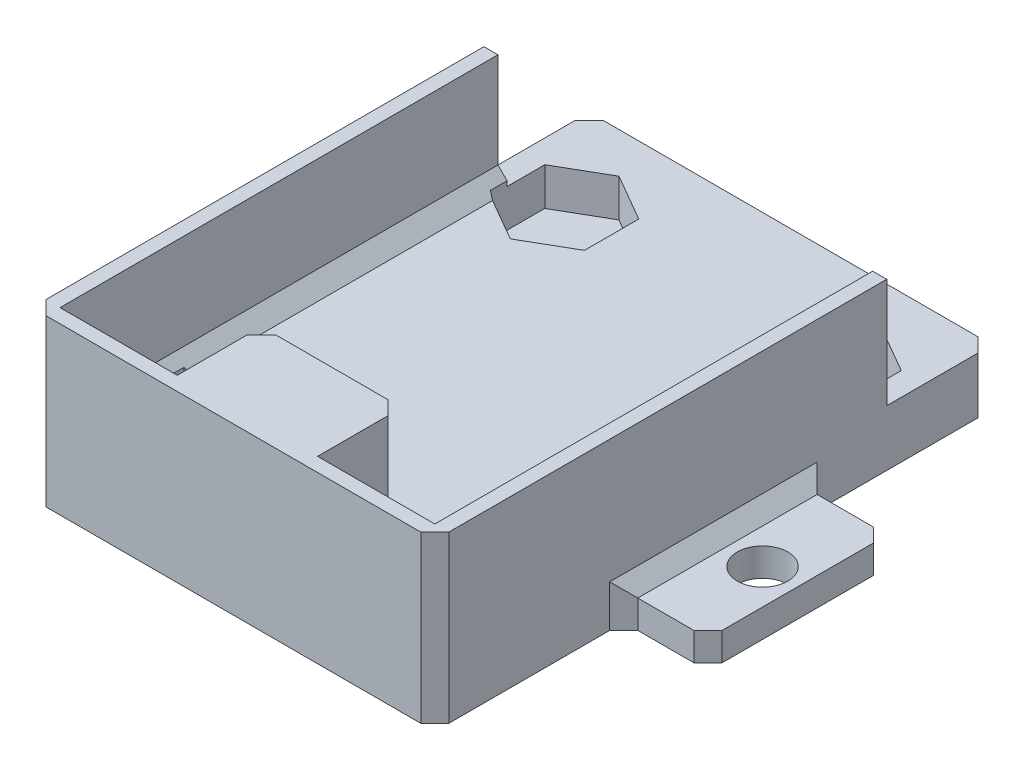
from build123d import *

# Parameters (mm, degrees)
SKETCH2_W               = 28.7
SKETCH2_H               = 39.7
BOSS_EXTRUDE1_DEPTH     = 10.8
SKETCH3_W               = 26.7
SKETCH3_H               = 37.7
CUT_EXTRUDE1_DEPTH      = 7.8
CUT_EXTRUDE2_DEPTH      = 37.528790016
CUT_EXTRUDE2_DEPTH_BACK = 37.528790016
SKETCH4_W               = 7.5
SKETCH4_H               = 7.8
SKETCH6_W               = 28.7
SKETCH6_H               = 39.7
BOSS_EXTRUDE2_DEPTH     = 1
CUT_EXTRUDE3_DEPTH      = 26.705738659
CUT_EXTRUDE3_DEPTH_BACK = 2.7
SKETCH10_W              = 12.7769089
SKETCH10_H              = 2
BOSS_EXTRUDE3_DEPTH     = 6
SKETCH11_R              = 1.8
CUT_EXTRUDE4_DEPTH      = 31.069669104
SKETCH12_W              = 12.78
SKETCH12_H              = 2
BOSS_EXTRUDE4_DEPTH     = 6
SKETCH14_R              = 1.8
CUT_EXTRUDE5_DEPTH      = 31.069669104
CHAMFER1_SIZE           = 1
SKETCH16_W              = 10
SKETCH16_H              = 6
BOSS_EXTRUDE5_DEPTH     = 7.8
CHAMFER2_SIZE           = 1


with BuildPart() as part:
    # Sketch2 → Boss-Extrude1 (new body)
    with BuildSketch(Plane(origin=(0, 0, 0), x_dir=(1, 0, 0), z_dir=(0, 1, 0))):
        Rectangle(SKETCH2_W, SKETCH2_H)
    extrude(amount=BOSS_EXTRUDE1_DEPTH)

    # Sketch3 → Cut-Extrude1 (cut)
    with BuildSketch(Plane(origin=(0, 10.8, 0), x_dir=(1, 0, 0), z_dir=(0, 1, 0))):
        Rectangle(SKETCH3_W, SKETCH3_H)
    extrude(amount=-CUT_EXTRUDE1_DEPTH, mode=Mode.SUBTRACT)

    # Sketch4 → Cut-Extrude2 (cut, two sides: drawn at the far end of the back side and taken through both)
    with BuildSketch(Plane(origin=(14.35, 0, 0), x_dir=(0, 0, -1), z_dir=(1, 0, 0)).offset(-CUT_EXTRUDE2_DEPTH_BACK)):
        with Locations((16.1, 6.9)):
            Rectangle(SKETCH4_W, SKETCH4_H)
    extrude(amount=CUT_EXTRUDE2_DEPTH + CUT_EXTRUDE2_DEPTH_BACK, mode=Mode.SUBTRACT)

    # Sketch6 → Boss-Extrude2 (add)
    with BuildSketch(Plane.XZ):
        Rectangle(SKETCH6_W, SKETCH6_H)
    extrude(amount=BOSS_EXTRUDE2_DEPTH)

    # Sketch9 → Cut-Extrude3 (cut, two sides: drawn at the far end of the back side and taken through both)
    with BuildSketch(Plane(origin=(0, 3, 0), x_dir=(1, 0, 0), z_dir=(0, 1, 0)).offset(-CUT_EXTRUDE3_DEPTH_BACK)):
        Polygon((-9.35, -8.731753196), (-12.7, -10.665876598), (-12.7, -14.534123402), (-9.35, -16.468246804), (-6, -14.534123402), (-6, -10.665876598), align=None)
        Polygon((9.35, -8.731753196), (6, -10.665876598), (6, -14.534123402), (9.35, -16.468246804), (12.7, -14.534123402), (12.7, -10.665876598), align=None)
        Polygon((-9.35, 16.968246804), (-12.7, 15.034123402), (-12.7, 11.165876598), (-9.35, 9.231753196), (-6, 11.165876598), (-6, 15.034123402), align=None)
        Polygon((9.35, 16.968246804), (6, 15.034123402), (6, 11.165876598), (9.35, 9.231753196), (12.7, 11.165876598), (12.7, 15.034123402), align=None)
    extrude(amount=CUT_EXTRUDE3_DEPTH + CUT_EXTRUDE3_DEPTH_BACK, mode=Mode.SUBTRACT)

    # Sketch10 → Boss-Extrude3 (add)
    with BuildSketch(Plane(origin=(14.35, 0, 0), x_dir=(0, 0, -1), z_dir=(1, 0, 0))):
        Rectangle(SKETCH10_W, SKETCH10_H)
    extrude(amount=BOSS_EXTRUDE3_DEPTH)

    # Sketch11 → Cut-Extrude4 (cut, through all)
    with BuildSketch(Plane(origin=(0, 1, 0), x_dir=(1, 0, 0), z_dir=(0, 1, 0))):
        with Locations(Location((17.85, 0, 0), (0, 0, 270))):
            Circle(SKETCH11_R)
    extrude(amount=-CUT_EXTRUDE4_DEPTH, mode=Mode.SUBTRACT)

    # Sketch12 → Boss-Extrude4 (add)
    with BuildSketch(Plane.ZY.offset(14.35)):
        Rectangle(SKETCH12_W, SKETCH12_H)
    extrude(amount=BOSS_EXTRUDE4_DEPTH)

    # Sketch14 → Cut-Extrude5 (cut, through all)
    with BuildSketch(Plane(origin=(0, 1, 0), x_dir=(1, 0, 0), z_dir=(0, 1, 0))):
        with Locations(Location((-17.85, 0, 0), (0, 0, 270))):
            Circle(SKETCH14_R)
    extrude(amount=-CUT_EXTRUDE5_DEPTH, mode=Mode.SUBTRACT)

    # Chamfer1
    chamfer1_edges = [part.edges().sort_by_distance(p)[0] for p in [
        (14.35, 0, -6.38845445),
        (14.35, 1, 0),
        (14.35, 0, 6.38845445),
        (20.35, 0, -6.38845445),
        (20.35, 0, 6.38845445),
        (-14.35, 0, 6.39),
        (-14.35, 1, 0),
        (-14.35, 0, -6.39),
        (-20.35, 0, 6.39),
        (-20.35, 0, -6.39),
        (-14.35, 1, -19.85),
        (14.35, 1, -19.85),
        (14.35, 4.9, 19.85),
        (-14.35, 4.9, 19.85),
    ]]
    chamfer(chamfer1_edges, length=CHAMFER1_SIZE)

    # Sketch16 → Boss-Extrude5 (add)
    with BuildSketch(Plane(origin=(0, 3, 0), x_dir=(1, 0, 0), z_dir=(0, 1, 0))):
        with Locations((0, -15.85)):
            Rectangle(SKETCH16_W, SKETCH16_H)
    extrude(amount=BOSS_EXTRUDE5_DEPTH)

    # Chamfer2
    # the kernel refuses this chamfer: 1 mm, written as the material it adds along each edge
    with BuildSketch(Plane(origin=(13.35, 3, 18.85), x_dir=(0.027495876610585623, 0.9996219169112968, 0), z_dir=(0, 0, -1))) as chamfer2_piece_1_section:
        Polygon((CHAMFER2_SIZE * 0.999621916911, -CHAMFER2_SIZE * 0.0274958766106), (-CHAMFER2_SIZE * 0.0274958766106, -CHAMFER2_SIZE * 0.999621916911), (0, 0), align=None)
    chamfer2_piece_1 = extrude(amount=31.2, mode=Mode.PRIVATE)
    chamfer2_piece_1 = split(chamfer2_piece_1, bisect_by=Plane(origin=(12.111347434, 3.369117542, 14.873982119), z_dir=(0.500000000000001, 0, 0.8660254037844382)), keep=Keep.TOP, mode=Mode.PRIVATE)
    chamfer2_piece_1 = split(chamfer2_piece_1, bisect_by=Plane(origin=(12.7, 3.369117542, 16.577989782), z_dir=(1, 0, 0)), keep=Keep.TOP, mode=Mode.PRIVATE)
    add(chamfer2_piece_1)
    with BuildSketch(Plane(origin=(13.35, 3, 18.85), x_dir=(0.027495876610585623, 0.9996219169112968, 0), z_dir=(0, 0, -1))) as chamfer2_piece_2_section:
        Polygon((CHAMFER2_SIZE * 0.999621916911, -CHAMFER2_SIZE * 0.0274958766106), (-CHAMFER2_SIZE * 0.0274958766106, -CHAMFER2_SIZE * 0.999621916911), (0, 0), align=None)
    chamfer2_piece_2 = extrude(amount=31.2, mode=Mode.PRIVATE)
    chamfer2_piece_2 = split(chamfer2_piece_2, bisect_by=Plane(origin=(11.651023247, 3.093736145, 15.139750413), z_dir=(0.500000000000001, 0, 0.8660254037844382)), keep=Keep.TOP, mode=Mode.PRIVATE)
    chamfer2_piece_2 = split(chamfer2_piece_2, bisect_by=Plane(origin=(12.7, 3.093736145, 16.729857379), z_dir=(-1, 0, 0)), keep=Keep.TOP, mode=Mode.PRIVATE)
    add(chamfer2_piece_2)
    with BuildSketch(Plane(origin=(13.35, 3, 18.85), x_dir=(0.027495876610585623, 0.9996219169112968, 0), z_dir=(0, 0, -1))) as chamfer2_piece_3_section:
        Polygon((CHAMFER2_SIZE * 0.999621916911, -CHAMFER2_SIZE * 0.0274958766106), (-CHAMFER2_SIZE * 0.0274958766106, -CHAMFER2_SIZE * 0.999621916911), (0, 0), align=None)
    chamfer2_piece_3 = extrude(amount=31.2, mode=Mode.PRIVATE)
    chamfer2_piece_3 = split(chamfer2_piece_3, bisect_by=Plane(origin=(13.821591652, 3.360169767, 13.886572159), z_dir=(-0.500000000000001, 0, -0.8660254037844382)), keep=Keep.TOP, mode=Mode.PRIVATE)
    chamfer2_piece_3 = split(chamfer2_piece_3, bisect_by=Plane(origin=(13.821591652, 3.360169767, 11.313427841), z_dir=(-0.5000000000000001, 0, 0.8660254037844386)), keep=Keep.TOP, mode=Mode.PRIVATE)
    chamfer2_piece_3 = split(chamfer2_piece_3, bisect_by=Plane(origin=(12.7, 3.360169767, 12.6), z_dir=(1, 0, 0)), keep=Keep.TOP, mode=Mode.PRIVATE)
    add(chamfer2_piece_3)
    with BuildSketch(Plane(origin=(13.35, 3, 18.85), x_dir=(0.027495876610585623, 0.9996219169112968, 0), z_dir=(0, 0, -1))) as chamfer2_piece_4_section:
        Polygon((CHAMFER2_SIZE * 0.999621916911, -CHAMFER2_SIZE * 0.0274958766106), (-CHAMFER2_SIZE * 0.0274958766106, -CHAMFER2_SIZE * 0.999621916911), (0, 0), align=None)
    chamfer2_piece_4 = extrude(amount=31.2, mode=Mode.PRIVATE)
    chamfer2_piece_4 = split(chamfer2_piece_4, bisect_by=Plane(origin=(8.267666364, 3.367668541, 8.10686758), z_dir=(0.5000000000000001, 0, -0.8660254037844386)), keep=Keep.TOP, mode=Mode.PRIVATE)
    chamfer2_piece_4 = split(chamfer2_piece_4, bisect_by=Plane(origin=(12.7, 3.367668541, -0.25), z_dir=(1, 0, 0)), keep=Keep.TOP, mode=Mode.PRIVATE)
    chamfer2_piece_4 = split(chamfer2_piece_4, bisect_by=Plane(origin=(8.267666364, 3.367668541, -8.60686758), z_dir=(0.5000000000000003, 0, 0.8660254037844387)), keep=Keep.TOP, mode=Mode.PRIVATE)
    add(chamfer2_piece_4)
    with BuildSketch(Plane(origin=(13.35, 3, 18.85), x_dir=(0.027495876610585623, 0.9996219169112968, 0), z_dir=(0, 0, -1))) as chamfer2_piece_5_section:
        Polygon((CHAMFER2_SIZE * 0.999621916911, -CHAMFER2_SIZE * 0.0274958766106), (-CHAMFER2_SIZE * 0.0274958766106, -CHAMFER2_SIZE * 0.999621916911), (0, 0), align=None)
    chamfer2_piece_5 = extrude(amount=31.2, mode=Mode.PRIVATE)
    chamfer2_piece_5 = split(chamfer2_piece_5, bisect_by=Plane(origin=(7.874549458, 3.093354027, 7.879901429), z_dir=(0.5000000000000001, 0, -0.8660254037844386)), keep=Keep.TOP, mode=Mode.PRIVATE)
    chamfer2_piece_5 = split(chamfer2_piece_5, bisect_by=Plane(origin=(12.7, 3.093354027, -0.25), z_dir=(-1, 0, 0)), keep=Keep.TOP, mode=Mode.PRIVATE)
    chamfer2_piece_5 = split(chamfer2_piece_5, bisect_by=Plane(origin=(7.874549458, 3.093354027, -8.379901429), z_dir=(0.5000000000000003, 0, 0.8660254037844387)), keep=Keep.TOP, mode=Mode.PRIVATE)
    add(chamfer2_piece_5)
    with BuildSketch(Plane(origin=(13.35, 3, 18.85), x_dir=(0.027495876610585623, 0.9996219169112968, 0), z_dir=(0, 0, -1))) as chamfer2_piece_6_section:
        Polygon((CHAMFER2_SIZE * 0.999621916911, -CHAMFER2_SIZE * 0.0274958766106), (-CHAMFER2_SIZE * 0.0274958766106, -CHAMFER2_SIZE * 0.999621916911), (0, 0), align=None)
    chamfer2_piece_6 = extrude(amount=31.2, mode=Mode.PRIVATE)
    chamfer2_piece_6 = split(chamfer2_piece_6, bisect_by=Plane(origin=(12.7, 3.355082682, -11.864598925), z_dir=(1, 0, 0)), keep=Keep.TOP, mode=Mode.PRIVATE)
    chamfer2_piece_6 = split(chamfer2_piece_6, bisect_by=Plane(origin=(13.279668077, 3.355082682, -11.500548118), z_dir=(-0.5000000000000003, 0, -0.8660254037844387)), keep=Keep.TOP, mode=Mode.PRIVATE)
    add(chamfer2_piece_6)
    with BuildSketch(Plane(origin=(-13.35, 3, 18.85), x_dir=(0, 0.9996219169112968, 0.027495876610585623), z_dir=(1, 0, 0)), Plane(origin=(2.428317012, 3, 18.85), x_dir=(0, 0.9996219169112968, 0.027495876610585623), z_dir=(1, 0, 0))) as chamfer2_piece_7:
        Polygon((CHAMFER2_SIZE * 0.999621916911, -CHAMFER2_SIZE * 0.0274958766106), (-CHAMFER2_SIZE * 0.0274958766106, -CHAMFER2_SIZE * 0.999621916911), (0, 0), align=None)
    extrude(amount=10.921682988)
    with BuildSketch(Plane(origin=(-13.35, 3, -12.35), x_dir=(-0.027495876610585623, 0.9996219169112968, 0), z_dir=(0, 0, 1))) as chamfer2_piece_8_section:
        Polygon((CHAMFER2_SIZE * 0.999621916911, -CHAMFER2_SIZE * 0.0274958766106), (-CHAMFER2_SIZE * 0.0274958766106, -CHAMFER2_SIZE * 0.999621916911), (0, 0), align=None)
    chamfer2_piece_8 = extrude(amount=31.2, mode=Mode.PRIVATE)
    chamfer2_piece_8 = split(chamfer2_piece_8, bisect_by=Plane(origin=(-12.7, 3.355082682, -11.864598925), z_dir=(-1, 0, 0)), keep=Keep.TOP, mode=Mode.PRIVATE)
    chamfer2_piece_8 = split(chamfer2_piece_8, bisect_by=Plane(origin=(-13.279668077, 3.355082682, -11.500548118), z_dir=(0.5000000000000003, 0, -0.8660254037844387)), keep=Keep.TOP, mode=Mode.PRIVATE)
    add(chamfer2_piece_8)
    with BuildSketch(Plane(origin=(-13.35, 3, -12.35), x_dir=(-0.027495876610585623, 0.9996219169112968, 0), z_dir=(0, 0, 1))) as chamfer2_piece_9_section:
        Polygon((CHAMFER2_SIZE * 0.999621916911, -CHAMFER2_SIZE * 0.0274958766106), (-CHAMFER2_SIZE * 0.0274958766106, -CHAMFER2_SIZE * 0.999621916911), (0, 0), align=None)
    chamfer2_piece_9 = extrude(amount=31.2, mode=Mode.PRIVATE)
    chamfer2_piece_9 = split(chamfer2_piece_9, bisect_by=Plane(origin=(-12.7, 3.367668541, -0.25), z_dir=(-1, 0, 0)), keep=Keep.TOP, mode=Mode.PRIVATE)
    chamfer2_piece_9 = split(chamfer2_piece_9, bisect_by=Plane(origin=(-8.267666364, 3.367668541, 8.10686758), z_dir=(-0.49999999999999967, 0, -0.8660254037844389)), keep=Keep.TOP, mode=Mode.PRIVATE)
    chamfer2_piece_9 = split(chamfer2_piece_9, bisect_by=Plane(origin=(-8.267666364, 3.367668541, -8.60686758), z_dir=(-0.5000000000000003, 0, 0.8660254037844387)), keep=Keep.TOP, mode=Mode.PRIVATE)
    add(chamfer2_piece_9)
    with BuildSketch(Plane(origin=(-13.35, 3, -12.35), x_dir=(-0.027495876610585623, 0.9996219169112968, 0), z_dir=(0, 0, 1))) as chamfer2_piece_10_section:
        Polygon((CHAMFER2_SIZE * 0.999621916911, -CHAMFER2_SIZE * 0.0274958766106), (-CHAMFER2_SIZE * 0.0274958766106, -CHAMFER2_SIZE * 0.999621916911), (0, 0), align=None)
    chamfer2_piece_10 = extrude(amount=31.2, mode=Mode.PRIVATE)
    chamfer2_piece_10 = split(chamfer2_piece_10, bisect_by=Plane(origin=(-12.7, 3.093354027, -0.25), z_dir=(1, 0, 0)), keep=Keep.TOP, mode=Mode.PRIVATE)
    chamfer2_piece_10 = split(chamfer2_piece_10, bisect_by=Plane(origin=(-7.874549458, 3.093354027, 7.879901429), z_dir=(-0.49999999999999967, 0, -0.8660254037844389)), keep=Keep.TOP, mode=Mode.PRIVATE)
    chamfer2_piece_10 = split(chamfer2_piece_10, bisect_by=Plane(origin=(-7.874549458, 3.093354027, -8.379901429), z_dir=(-0.5000000000000003, 0, 0.8660254037844387)), keep=Keep.TOP, mode=Mode.PRIVATE)
    add(chamfer2_piece_10)
    with BuildSketch(Plane(origin=(-13.35, 3, -12.35), x_dir=(-0.027495876610585623, 0.9996219169112968, 0), z_dir=(0, 0, 1))) as chamfer2_piece_11_section:
        Polygon((CHAMFER2_SIZE * 0.999621916911, -CHAMFER2_SIZE * 0.0274958766106), (-CHAMFER2_SIZE * 0.0274958766106, -CHAMFER2_SIZE * 0.999621916911), (0, 0), align=None)
    chamfer2_piece_11 = extrude(amount=31.2, mode=Mode.PRIVATE)
    chamfer2_piece_11 = split(chamfer2_piece_11, bisect_by=Plane(origin=(-12.7, 3.360169767, 12.6), z_dir=(-1, 0, 0)), keep=Keep.TOP, mode=Mode.PRIVATE)
    chamfer2_piece_11 = split(chamfer2_piece_11, bisect_by=Plane(origin=(-13.821591652, 3.360169767, 13.886572159), z_dir=(0.4999999999999996, 0, -0.8660254037844389)), keep=Keep.TOP, mode=Mode.PRIVATE)
    chamfer2_piece_11 = split(chamfer2_piece_11, bisect_by=Plane(origin=(-13.821591652, 3.360169767, 11.313427841), z_dir=(0.49999999999999967, 0, 0.8660254037844389)), keep=Keep.TOP, mode=Mode.PRIVATE)
    add(chamfer2_piece_11)
    with BuildSketch(Plane(origin=(-13.35, 3, -12.35), x_dir=(-0.027495876610585623, 0.9996219169112968, 0), z_dir=(0, 0, 1))) as chamfer2_piece_12_section:
        Polygon((CHAMFER2_SIZE * 0.999621916911, -CHAMFER2_SIZE * 0.0274958766106), (-CHAMFER2_SIZE * 0.0274958766106, -CHAMFER2_SIZE * 0.999621916911), (0, 0), align=None)
    chamfer2_piece_12 = extrude(amount=31.2, mode=Mode.PRIVATE)
    chamfer2_piece_12 = split(chamfer2_piece_12, bisect_by=Plane(origin=(-12.7, 3.369117542, 16.577989782), z_dir=(-1, 0, 0)), keep=Keep.TOP, mode=Mode.PRIVATE)
    chamfer2_piece_12 = split(chamfer2_piece_12, bisect_by=Plane(origin=(-12.111347434, 3.369117542, 14.873982119), z_dir=(-0.4999999999999996, 0, 0.8660254037844389)), keep=Keep.TOP, mode=Mode.PRIVATE)
    add(chamfer2_piece_12)
    with BuildSketch(Plane(origin=(-13.35, 3, -12.35), x_dir=(-0.027495876610585623, 0.9996219169112968, 0), z_dir=(0, 0, 1))) as chamfer2_piece_13_section:
        Polygon((CHAMFER2_SIZE * 0.999621916911, -CHAMFER2_SIZE * 0.0274958766106), (-CHAMFER2_SIZE * 0.0274958766106, -CHAMFER2_SIZE * 0.999621916911), (0, 0), align=None)
    chamfer2_piece_13 = extrude(amount=31.2, mode=Mode.PRIVATE)
    chamfer2_piece_13 = split(chamfer2_piece_13, bisect_by=Plane(origin=(-12.7, 3.093736145, 16.729857379), z_dir=(1, 0, 0)), keep=Keep.TOP, mode=Mode.PRIVATE)
    chamfer2_piece_13 = split(chamfer2_piece_13, bisect_by=Plane(origin=(-11.651023247, 3.093736145, 15.139750413), z_dir=(-0.4999999999999996, 0, 0.8660254037844389)), keep=Keep.TOP, mode=Mode.PRIVATE)
    add(chamfer2_piece_13)
    # the kernel refuses this chamfer: 1 mm, written as the material it takes off along each edge
    with BuildSketch(Plane(origin=(-5, 3, 12.85), x_dir=(0.9996219169112968, 0, -0.027495876610585623), z_dir=(0, 1, 0)), Plane(origin=(5, 3, 12.85), x_dir=(0.02749587661058651, 0, 0.9996219169112968), z_dir=(0, 1, 0))) as chamfer2_2_piece_1:
        Polygon((CHAMFER2_SIZE * 0.999621916911, -CHAMFER2_SIZE * 0.0274958766106), (-CHAMFER2_SIZE * 0.0274958766106, -CHAMFER2_SIZE * 0.999621916911), (0, 0), align=None)
    extrude(amount=10.371682988, mode=Mode.SUBTRACT)


solid = part.part
